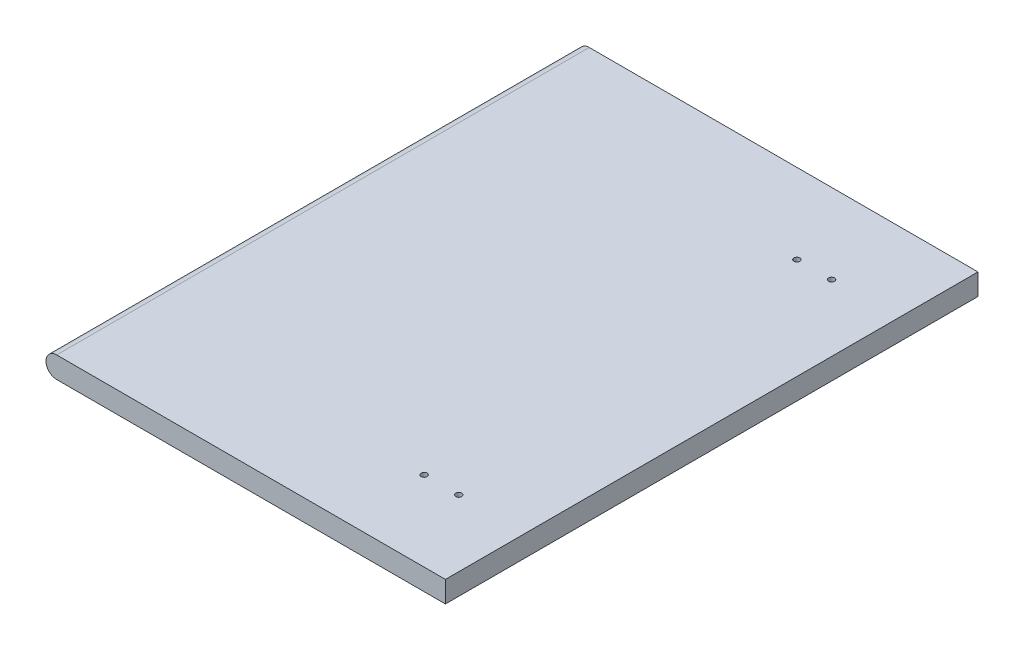
from build123d import *

# Parameters (mm, degrees)
SKETCH1_W                                 = 300
SKETCH1_H                                 = 400
BOSS_EXTRUDE1_DEPTH                       = 16
CSK_FOR_8_FLAT_HEAD_MACHINE_SCREW_2_COUNT = 2
CSK_FOR_8_FLAT_HEAD_MACHINE_SCREW_2_PITCH = 26
FILLET1_R                                 = 8


with BuildPart() as part:
    # Sketch1 → Boss-Extrude1 (new body)
    with BuildSketch(Plane(origin=(0, 0, 0), x_dir=(1, 0, 0), z_dir=(0, 1, 0))):
        Rectangle(SKETCH1_W, SKETCH1_H)
    extrude(amount=BOSS_EXTRUDE1_DEPTH)

    # Sketch8 → CSK for #8 Flat Head Machine Screw (100)1 (revolve, cut)
    with BuildSketch(Plane(origin=(100, 0, 140), x_dir=(0, 0, -1), z_dir=(1, 0, 0))):
        Polygon((0, 0), (0, 26.350674586), (2.2479, 25), (2.2479, 1.651767624), (4.2164, 0), align=None)
    csk_for_8_flat_head_machine_screw_100 = revolve(axis=Axis((100, -6.35, 140), (0, 1, 0)), mode=Mode.SUBTRACT)

    # CSK for _8 Flat Head Machine Screw _ 2: CSK for #8 Flat Head Machine Screw (100)1 ×2
    with Locations(*[(-i * CSK_FOR_8_FLAT_HEAD_MACHINE_SCREW_2_PITCH, 0, 0) for i in range(1, CSK_FOR_8_FLAT_HEAD_MACHINE_SCREW_2_COUNT)]):
        add(csk_for_8_flat_head_machine_screw_100, mode=Mode.SUBTRACT)

    # Mirror1: CSK for #8 Flat Head Machine Screw (100)1 across plane
    add(csk_for_8_flat_head_machine_screw_100.mirror(Plane.XY), mode=Mode.SUBTRACT)

    # Mirror1 copy 1 sketch → Mirror1 copy 1 (revolve, cut)
    with BuildSketch(Plane(origin=(74, 0, -140), x_dir=(0, 0, 1), z_dir=(1, 0, 0))):
        Polygon((0, 0), (0, -26.350674586), (2.2479, -25), (2.2479, -1.651767624), (4.2164, 0), align=None)
    revolve(axis=Axis((74, -6.35, -140), (0, -1, 0)), mode=Mode.SUBTRACT)

    # Fillet1
    fillet1_edges = [part.edges().sort_by_distance(p)[0] for p in [
        (-150, 16, 0),
        (-150, 0, 0),
    ]]
    fillet(fillet1_edges, radius=FILLET1_R - 0.0001)  # a hair under: the kernel refuses the full size


solid = part.part
